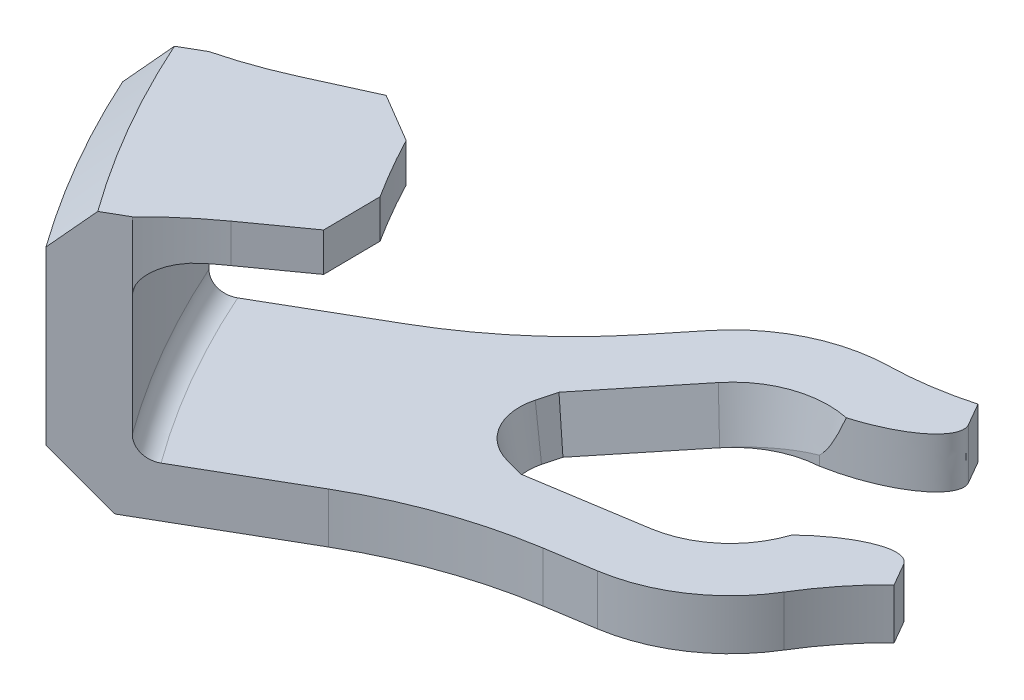
from build123d import *

# Parameters (mm, degrees)
EXTRUDE_1_DEPTH     = 2.4
EXTRUDE_1_DRAFT     = 10
EXTRUDE_2_DEPTH     = 12.4
EXTRUDE_4_DEPTH     = 2.4
EXTRUDE_START       = -1.84
EXTRUDE_3_DEPTH     = 1.84
CHAMFER_1_SIZE      = 2.4
FILLET_3_R          = 1
FILLET_4_R          = 19
CHAMFER_2_SIZE      = 1.5
CHAMFER_3_SIZE      = 1.5
FILLET_5_SIZE       = 2.4
FILLET_5_SIZE_2     = 1.4
FILLET_8_R          = 15
CUT_EXTRUDE_2_DEPTH = 5
FILLET_6_DEPTH      = 2.4
FILLET_7_DEPTH      = 2.4
CHAMFER_4_SIZE      = 1.8
FILLET_9_R          = 22


with BuildPart() as part:
    # 草图1 → 凸台-拉伸1 (with draft: the straight prism first)
    with BuildSketch(Plane(origin=(0, 0, 0), x_dir=(1, 0, 0), z_dir=(0, 1, 0))):
        with BuildLine():
            Line((-8, -10.392304845), (-13, -1.732050808))
            Line((-13, -1.732050808), (-21.967816979, -6.909622355))
            Line((-21.967816979, -6.909622355), (-22.707395472, -6.711455524))
            ThreePointArc((-22.707395472, -6.711455524), (-27.045667208, -6.825066474), (-30.622176838, -9.283132374))
            Line((-30.622176838, -9.283132374), (-34.43427487, -13.990668154))
            Line((-34.43427487, -13.990668154), (-34.611399325, -14.209398026))
            Line((-34.611399325, -14.209398026), (-44.088841542, -19.681201841))
            ThreePointArc((-44.088841542, -19.681201841), (-41.813654956, -24.141124945), (-39.088841542, -28.341455878))
            Line((-39.088841542, -28.341455878), (-29.611399325, -22.869652063))
            Line((-29.611399325, -22.869652063), (-29.333411472, -22.825622721))
            Line((-29.333411472, -22.825622721), (-23.350516885, -21.878016874))
            ThreePointArc((-23.350516885, -21.878016874), (-19.433514554, -20.009701627), (-17.165988715, -16.309453567))
            Line((-17.165988715, -16.309453567), (-16.967816979, -15.569876393))
            Line((-16.967816979, -15.569876393), (-8, -10.392304845))
        make_face()
        with BuildLine():
            Line((-27.917710858, -11.473169763), (-31.264303283, -15.605855609))
            Line((-31.264303283, -15.605855609), (-31.480162481, -16.411447438))
            ThreePointArc((-31.480162481, -16.411447438), (-31.264379417, -18.05049777), (-29.952811807, -19.056896659))
            Line((-29.952811807, -19.056896659), (-29.147219046, -19.27275307))
            Line((-29.147219046, -19.27275307), (-23.894912088, -18.440861966))
            ThreePointArc((-23.894912088, -18.440861966), (-21.762087, -17.423555776), (-20.527408298, -15.408754734))
            Line((-20.527408298, -15.408754734), (-19.958845574, -13.286877913))
            ThreePointArc((-19.958845574, -13.286877913), (-20.174626779, -11.647826039), (-21.486196869, -10.641428268))
            Line((-21.486196869, -10.641428268), (-23.608077089, -10.07287972))
            ThreePointArc((-23.608077089, -10.07287972), (-25.97028529, -10.134742248), (-27.917710858, -11.473169763))
        make_face(mode=Mode.SUBTRACT)
    extrude(amount=EXTRUDE_1_DEPTH)
    # 凸台-拉伸1: the draft: its side faces are tilted about the plane it starts from
    extrude_1_sides = [part.faces().sort_by_distance(p)[0] for p in [
        (-26.480958105, 1.2, 22.373834469),
        (-29.59100707, 1.2, 13.539512686),
        (-31.372232882, 1.2, 16.008651523),
        (-31.264379417, 1.2, 18.05049777),
        (-29.550015427, 1.2, 19.164824864),
        (-26.521065567, 1.2, 18.856807518),
        (-21.762087, 1.2, 17.423555776),
        (-20.243126936, 1.2, 14.347816323),
        (-20.174626779, 1.2, 11.647826039),
        (-22.547136979, 1.2, 10.357153994),
        (-25.97028529, 1.2, 10.134742248),
        (-41.813654956, 1.2, 24.141124945),
        (-39.350120434, 1.2, 16.945299933),
        (-32.616788082, 1.2, 11.7462652),
        (-27.045667208, 1.2, 6.825066474),
        (-22.337606226, 1.2, 6.810538939),
        (-17.48390849, 1.2, 4.320836581),
        (-10.5, 1.2, 6.062177826),
        (-12.48390849, 1.2, 12.981090619),
        (-17.066902847, 1.2, 15.93966498),
        (-34.350120433, 1.2, 25.605553971),
        (-19.433514554, 1.2, 20.009701627),
    ]]
    draft(extrude_1_sides, Plane(origin=(0, 0, 0), x_dir=(1, 0, 0), z_dir=(0, 1, 0)), EXTRUDE_1_DRAFT)



with BuildPart() as body_2:
    # 草图3 → 凸台-拉伸2 (new body)
    with BuildSketch(Plane.XZ):
        with BuildLine():
            Line((-39.088841542, 28.341455878), (-41.700134223, 29.849086411))
            ThreePointArc((-41.700134223, 29.849086411), (-44.411731167, 25.641124945), (-46.700134223, 21.188832373))
            Line((-46.700134223, 21.188832373), (-44.088841542, 19.681201841))
            ThreePointArc((-44.088841542, 19.681201841), (-41.813654956, 24.141124945), (-39.088841542, 28.341455878))
        make_face()
    extrude(amount=-EXTRUDE_2_DEPTH)


with BuildPart() as part_1:
    add(part.part)

    add(body_2.part)  # 凸台-拉伸4 merges body 2
    # 草图2 → 凸台-拉伸4 (add)
    with BuildSketch(Plane.XZ):
        with BuildLine():
            Line((-13, 1.732050808), (-8, 10.392304845))
            Line((-8, 10.392304845), (-16.967816979, 15.569876393))
            Line((-16.967816979, 15.569876393), (-17.165988715, 16.309453567))
            ThreePointArc((-17.165988715, 16.309453567), (-19.433514554, 20.009701627), (-23.350516885, 21.878016874))
            Line((-23.350516885, 21.878016874), (-29.611399325, 22.869652063))
            Line((-29.611399325, 22.869652063), (-39.088841542, 28.341455878))
            ThreePointArc((-39.088841542, 28.341455878), (-41.813654956, 24.141124945), (-44.088841542, 19.681201841))
            Line((-44.088841542, 19.681201841), (-34.611399325, 14.209398026))
            Line((-34.611399325, 14.209398026), (-30.622176838, 9.283132374))
            ThreePointArc((-30.622176838, 9.283132374), (-27.045667208, 6.825066474), (-22.707395472, 6.711455524))
            Line((-22.707395472, 6.711455524), (-21.967816979, 6.909622355))
            Line((-21.967816979, 6.909622355), (-13, 1.732050808))
        make_face()
        Polygon((-28.267922288, 9.695660603), (-32.994912051, 15.569876392), (-31.812956682, 19.594100966), (-26.346816011, 20.919608689), (-19.040272004, 17.121163853), (-18.489608424, 9.956624946), (-26.72941961, 8.295337377), align=None, mode=Mode.SUBTRACT)
    extrude(amount=-EXTRUDE_4_DEPTH)

    # 草图4 → 凸台-拉伸3 (add)
    with BuildSketch(Plane(origin=(0, 12.4, 0), x_dir=(1, 0, 0), z_dir=(0, 1, 0)).offset(EXTRUDE_START)):
        with BuildLine():
            Line((-36.682994227, -16.643845431), (-46.700134223, -21.188832373))
            ThreePointArc((-46.700134223, -21.188832373), (-44.411731167, -25.641124945), (-41.700134223, -29.849086411))
            Line((-41.700134223, -29.849086411), (-32.755490073, -23.446482172))
            ThreePointArc((-32.755490073, -23.446482172), (-34.885451726, -20.141124945), (-36.682994227, -16.643845431))
        make_face()
    extrude(amount=EXTRUDE_3_DEPTH)

    # 倒角1
    chamfer_1_edges = [part_1.edges().sort_by_distance(p)[0] for p in [
        (-44.411731167, 0, 25.641124945),
    ]]
    chamfer(chamfer_1_edges, length=CHAMFER_1_SIZE)

    # 圆角3
    fillet_3_edges = [part_1.edges().sort_by_distance(p)[0] for p in [
        (-41.813654956, 2.4, 24.141124945),
    ]]
    fillet(fillet_3_edges, radius=FILLET_3_R)

    # 圆角4
    # the kernel refuses this fillet: 19 mm, written as the material it adds along each edge
    with BuildSketch(Plane(origin=(-39.260685818, 12.4, 28.102921618), x_dir=(0.5845278463012991, 0, 0.8113736481414496), z_dir=(0, -1, 0))) as fillet_4_piece_1:
        with BuildLine():
            CenterArc((19.010051021, -3.272459571), FILLET_4_R, 170.082224445, 10.092211377)
            Line((0.010139075, -3.33030459), (0, 0))
            ThreePointArc((0, 0), (0.146994089, 0.00022376), (0.293988178, 0))
        make_face()
    extrude(amount=1.84)
    with BuildSketch(Plane(origin=(-43.968186951, 12.4, 19.949290479), x_dir=(-0.4104062681012657, 0, -0.9119027881869821), z_dir=(0, -1, 0))) as fillet_4_piece_2:
        with BuildLine():
            CenterArc((19.010051021, 3.272459571), FILLET_4_R, 179.825564179, 10.092211377)
            Line((0.010139075, 3.33030459), (0, 0))
            ThreePointArc((0, 0), (0.146994089, -0.00022376), (0.293988178, 0))
        make_face()
    extrude(amount=1.84)

    # 倒角2
    # the kernel refuses this chamfer: 2.14222201, 1.5 mm, written as the material it takes off along each edge
    with BuildSketch(Plane(origin=(-36.682994227, 4.801632278, 16.643845431), x_dir=(-0.910649090537952, 0, 0.4131806310833085), z_dir=(0, 1, 0))) as chamfer_2_piece_1:
        with BuildLine():
            Line((CHAMFER_2_SIZE, 0), (-0.061799745, 2.230481193))
            ThreePointArc((-0.061799745, 2.230481193), (-0.016460271, 1.151452368), (0, 0))
            Line((0, 0), (CHAMFER_2_SIZE, 0))
        make_face()
    extrude(amount=13.356735445, mode=Mode.SUBTRACT)

    # 倒角3
    # the kernel refuses this chamfer: 2.14222201, 1.5 mm, written as the material it takes off along each edge
    with BuildSketch(Plane(origin=(-32.755490073, 4.801632278, 23.446482172), x_dir=(-0.5593104278121883, 0, -0.8289582892646329), z_dir=(0, 1, 0))) as chamfer_3_piece_1:
        with BuildLine():
            Line((2.231337169, 0), (-CHAMFER_3_SIZE * 0.0276962827921, CHAMFER_3_SIZE * 0.999616384379))
            Line((-CHAMFER_3_SIZE * 0.0276962827921, CHAMFER_3_SIZE * 0.999616384379), (0, 0))
            ThreePointArc((0, 0), (1.151466541, 0.015436994), (2.231337169, 0))
        make_face()
    extrude(amount=13.356735445, mode=Mode.SUBTRACT)

    # 圆角5
    # a fillet whose section is not a circle: 2.4, 1.4 mm, written as the material it adds along each edge
    with BuildSketch(Plane(origin=(0, 10.56, 0), x_dir=(-0.8131494681386953, 0, 0.582054930797564), z_dir=(0.582054930797564, 0, 0.8131494681386953))) as fillet_5_piece_1:
        with BuildLine():
            Bezier((48.282249889 - FILLET_5_SIZE, 0), (48.282249889, 0), (48.282249889, FILLET_5_SIZE_2), weights=[1, 0.707106781, 1])
            Line((48.282249889, FILLET_5_SIZE_2), (48.282249889, 0))
            Line((48.282249889, 0), (48.282249889 - FILLET_5_SIZE, 0))
        make_face()
    revolve(axis=Axis((0, 10.56, 0), (0, -1, 0)), revolution_arc=11.190411394)
    with BuildSketch(Plane(origin=(-6e-08, 10.56, 4.3e-08), x_dir=(-0.8131494681413899, 0, 0.5820549307937993), z_dir=(-0.5820549307937993, 0, -0.8131494681413899))) as fillet_5_piece_2_section:
        with BuildLine():
            Bezier((48.282249815 - FILLET_5_SIZE, 0), (48.282249815, 0), (48.282249815, -FILLET_5_SIZE_2), weights=[1, 0.707106781, 1])
            Line((48.282249815, -FILLET_5_SIZE_2), (48.282249815, 0))
            Line((48.282249815, 0), (48.282249815 - FILLET_5_SIZE, 0))
        make_face()
    fillet_5_piece_2 = revolve(axis=Axis((-6e-08, 10.56, 4.3e-08), (0, 1, 0)), revolution_arc=7.468976453, mode=Mode.PRIVATE)
    fillet_5_piece_2 = fillet_5_piece_2 - Plane(origin=(-25.493594176, 10.56, 41.614332321), x_dir=(0.5845278463013154, 0, 0.8113736481414379), z_dir=(0, 1, 0)) * Cylinder(19, 194, mode=Mode.PRIVATE)
    add(fillet_5_piece_2)
    with BuildSketch(Plane(origin=(-6.8e-08, 10.56, 3e-08), x_dir=(-0.9106490905361394, 0, 0.4131806310873032), z_dir=(0.4131806310873032, 0, 0.9106490905361394))) as fillet_5_piece_3_section:
        with BuildLine():
            Bezier((48.282249815 - FILLET_5_SIZE, 0), (48.282249815, 0), (48.282249815, FILLET_5_SIZE_2), weights=[1, 0.707106781, 1])
            Line((48.282249815, FILLET_5_SIZE_2), (48.282249815, 0))
            Line((48.282249815, 0), (48.282249815 - FILLET_5_SIZE, 0))
        make_face()
    fillet_5_piece_3 = revolve(axis=Axis((-6.8e-08, 10.56, 3e-08), (0, -1, 0)), revolution_arc=7.468976453, mode=Mode.PRIVATE)
    fillet_5_piece_3 = fillet_5_piece_3 - Plane(origin=(-48.78586604, 10.56, 1.27093403), x_dir=(-0.4104062681010381, 0, -0.9119027881870846), z_dir=(0, 1, 0)) * Cylinder(19, 194, mode=Mode.PRIVATE)
    add(fillet_5_piece_3)

    # 圆角8
    fillet_8_edges = [part_1.edges().sort_by_distance(p)[0] for p in [
        (-16.967816979, 1.2, 15.569876393),
        (-21.967816979, 1.2, 6.909622355),
    ]]
    fillet(fillet_8_edges, radius=FILLET_8_R)

    # 草图5 → 切除-拉伸2 (cut)
    with BuildSketch(Plane.XZ):
        with BuildLine():
            Line((-29.147219046, 19.27275307), (-31.264303283, 15.605855609))
            Line((-31.264303283, 15.605855609), (-27.917710858, 11.473169763))
            ThreePointArc((-27.917710858, 11.473169763), (-26.519580592, 10.33421548), (-24.781854923, 9.852245982))
            ThreePointArc((-24.781854923, 9.852245982), (-22.061802465, 9.586923289), (-19.411053684, 8.921632073))
            Line((-19.411053684, 8.921632073), (-21.155274081, 5.900553727))
            Line((-21.155274081, 5.900553727), (-15.208253994, -4.420406035))
            Line((-15.208253994, -4.420406035), (0.192169605, 10.177783302))
            Line((0.192169605, 10.177783302), (-15.687666464, 15.370727914))
            Line((-15.687666464, 15.370727914), (-17.431886861, 12.349649567))
            ThreePointArc((-17.431886861, 12.349649567), (-19.333420345, 14.312619743), (-20.923222766, 16.535592924))
            ThreePointArc((-20.923222766, 16.535592924), (-22.209483528, 17.799522767), (-23.894912088, 18.440861966))
            Line((-23.894912088, 18.440861966), (-29.147219046, 19.27275307))
        make_face()
    extrude(amount=-CUT_EXTRUDE_2_DEPTH, mode=Mode.SUBTRACT)

    # 圆角6: read off the stored shape, not the designer's step
    # 圆角6 outline → 圆角6 (cut)
    with BuildSketch(Plane(origin=(0, 0, 0), x_dir=(1, 0, 0), z_dir=(0, 1, 0))):
        with BuildLine():
            Line((-19.411053684, -8.921632073), (-20.538770468, -6.968369307))
            add(Edge.make_bspline(
                [(-20.538770468, -6.968369307), (-19.421581423, -8.903397494), (-24.781854923, -9.852245982)],
                knots=[0, 0, 0, 1, 1, 1], degree=2, weights=[1, 0.573849647, 1]))
            ThreePointArc((-24.781854923, -9.852245982), (-22.061802466, -9.586923289), (-19.411053684, -8.921632073))
        make_face()
    extrude(amount=FILLET_6_DEPTH, mode=Mode.SUBTRACT)

    # 圆角7: read off the stored shape, not the designer's step
    # 圆角7 outline → 圆角7 (cut)
    with BuildSketch(Plane(origin=(0, 0, 0), x_dir=(1, 0, 0), z_dir=(0, 1, 0))):
        with BuildLine():
            ThreePointArc((-17.431886861, -12.349649567), (-19.333420346, -14.312619744), (-20.923222767, -16.535592926))
            add(Edge.make_bspline(
                [(-20.923222767, -16.535592926), (-17.421359117, -12.367884155), (-16.304170077, -14.302912333)],
                knots=[0, 0, 0, 1, 1, 1], degree=2, weights=[1, 0.573849648, 1]))
            Line((-16.304170077, -14.302912333), (-17.431886861, -12.349649567))
        make_face()
    extrude(amount=FILLET_7_DEPTH, mode=Mode.SUBTRACT)

    # 倒角4
    chamfer_4_edges = [part_1.edges().sort_by_distance(p)[0] for p in [
        (-44.411731167, 12.4, 25.641124945),
    ]]
    chamfer(chamfer_4_edges, length=CHAMFER_4_SIZE)

    # 圆角9
    fillet_9_edges = [part_1.edges().sort_by_distance(p)[0] for p in [
        (-34.611399325, 1.2, 14.209398026),
        (-29.611399325, 1.2, 22.869652063),
    ]]
    fillet(fillet_9_edges, radius=FILLET_9_R)


solid = part_1.part
